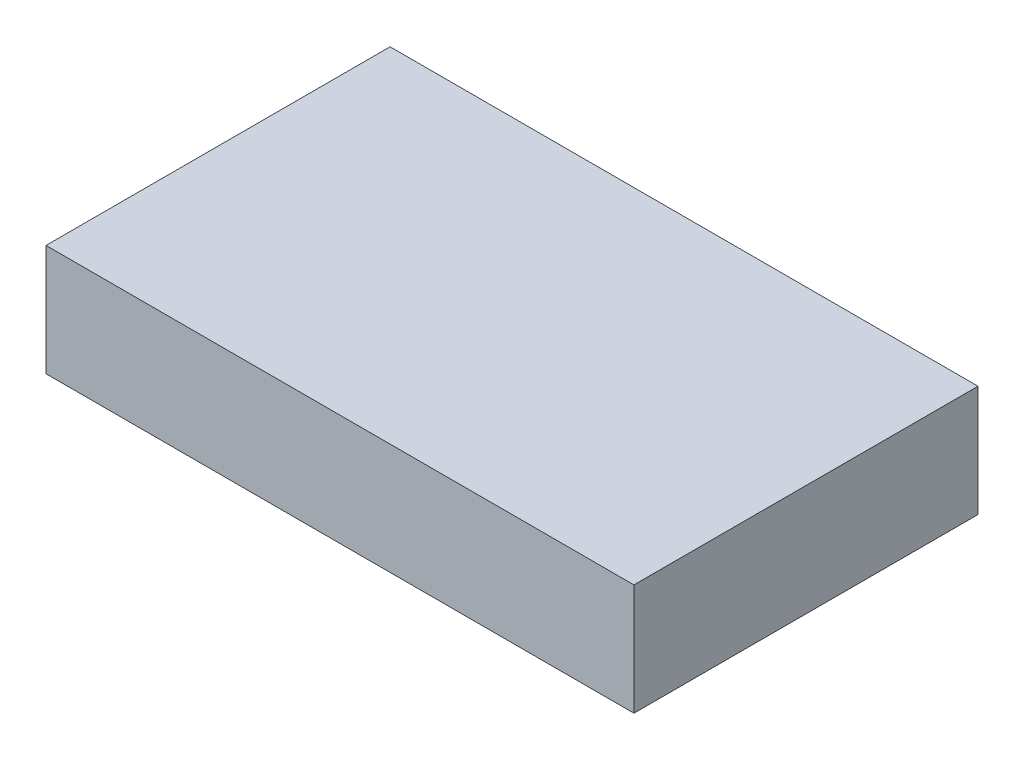
from build123d import *

# Parameters (mm, degrees)
SKETCH2_W           = 22.214358562
SKETCH2_H           = 4.2
BOSS_EXTRUDE1_DEPTH = 13


with BuildPart() as part:
    # Sketch2 → Boss-Extrude1 (new body)
    with BuildSketch(Plane.XY):
        Rectangle(SKETCH2_W, SKETCH2_H)
    extrude(amount=BOSS_EXTRUDE1_DEPTH)


solid = part.part
